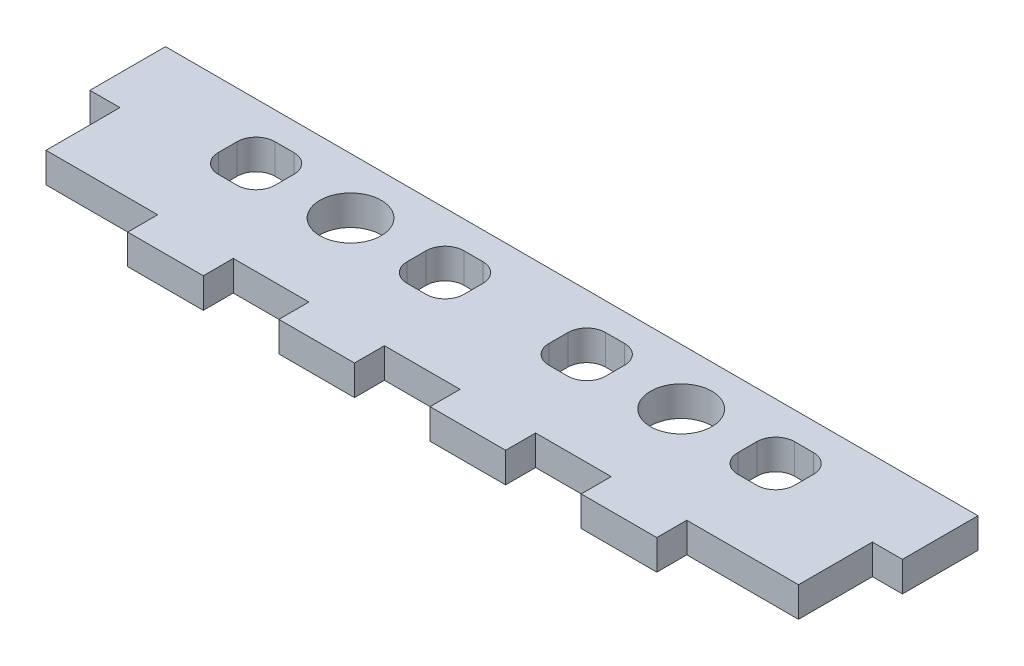
from build123d import *

# Parameters (mm, degrees)
SKETCH3_W           = 86
SKETCH3_H           = 30
BOSS_EXTRUDE1_DEPTH = 3.175
CUT_EXTRUDE1_REACH  = 93.138
SKETCH4_W           = 8
SKETCH4_H           = 3.175
SKETCH4_W_2         = 3.175
SKETCH4_H_2         = 11
CUT_EXTRUDE2_REACH  = 93.138
SKETCH5_R           = 3.25
CUT_EXTRUDE3_REACH  = 93.138
SKETCH6_W           = 79.65
SKETCH6_H           = 11
CUT_EXTRUDE4_REACH  = 93.138


with BuildPart() as part:
    # Sketch3 → Boss-Extrude1 (new body)
    with BuildSketch(Plane(origin=(0, 0, 0), x_dir=(1, 0, 0), z_dir=(0, 1, 0))):
        with Locations((43, -15)):
            Rectangle(SKETCH3_W, SKETCH3_H)
    extrude(amount=BOSS_EXTRUDE1_DEPTH)

    # Sketch4 → Cut-Extrude1 (cut, up to next)
    with BuildSketch(Plane(origin=(0, 3.175, 0), x_dir=(1, 0, 0), z_dir=(0, 1, 0)), mode=Mode.PRIVATE) as cut_extrude1_sk1:
        Polygon((0, -30), (15, -30), (15, -26.825), (3.175, -26.825), (3.175, -19), (0, -19), align=None)
    cut_extrude1_tool1 = extrude(cut_extrude1_sk1.sketch, amount=-CUT_EXTRUDE1_REACH, mode=Mode.PRIVATE) & part.part
    # Sketch4 → Cut-Extrude1 (cut, up to next)
    with BuildSketch(Plane(origin=(0, 3.175, 0), x_dir=(1, 0, 0), z_dir=(0, 1, 0)), mode=Mode.PRIVATE) as cut_extrude1_sk2:
        with Locations((27, -28.4125)):
            Rectangle(SKETCH4_W, SKETCH4_H)
    cut_extrude1_tool2 = extrude(cut_extrude1_sk2.sketch, amount=-CUT_EXTRUDE1_REACH, mode=Mode.PRIVATE) & part.part
    # Sketch4 → Cut-Extrude1 (cut, up to next)
    with BuildSketch(Plane(origin=(0, 3.175, 0), x_dir=(1, 0, 0), z_dir=(0, 1, 0)), mode=Mode.PRIVATE) as cut_extrude1_sk3:
        with Locations((43, -28.4125)):
            Rectangle(SKETCH4_W, SKETCH4_H)
    cut_extrude1_tool3 = extrude(cut_extrude1_sk3.sketch, amount=-CUT_EXTRUDE1_REACH, mode=Mode.PRIVATE) & part.part
    # Sketch4 → Cut-Extrude1 (cut, up to next)
    with BuildSketch(Plane(origin=(0, 3.175, 0), x_dir=(1, 0, 0), z_dir=(0, 1, 0)), mode=Mode.PRIVATE) as cut_extrude1_sk4:
        with Locations((1.5875, -5.5)):
            Rectangle(SKETCH4_W_2, SKETCH4_H_2)
    cut_extrude1_tool4 = extrude(cut_extrude1_sk4.sketch, amount=-CUT_EXTRUDE1_REACH, mode=Mode.PRIVATE) & part.part
    # Sketch4 → Cut-Extrude1 (cut, up to next)
    with BuildSketch(Plane(origin=(0, 3.175, 0), x_dir=(1, 0, 0), z_dir=(0, 1, 0)), mode=Mode.PRIVATE) as cut_extrude1_sk5:
        with Locations((59, -28.4125)):
            Rectangle(SKETCH4_W, SKETCH4_H)
    cut_extrude1_tool5 = extrude(cut_extrude1_sk5.sketch, amount=-CUT_EXTRUDE1_REACH, mode=Mode.PRIVATE) & part.part
    # Sketch4 → Cut-Extrude1 (cut, up to next)
    with BuildSketch(Plane(origin=(0, 3.175, 0), x_dir=(1, 0, 0), z_dir=(0, 1, 0)), mode=Mode.PRIVATE) as cut_extrude1_sk6:
        with Locations((84.4125, -5.5)):
            Rectangle(SKETCH4_W_2, SKETCH4_H_2)
    cut_extrude1_tool6 = extrude(cut_extrude1_sk6.sketch, amount=-CUT_EXTRUDE1_REACH, mode=Mode.PRIVATE) & part.part
    # Sketch4 → Cut-Extrude1 (cut, up to next)
    with BuildSketch(Plane(origin=(0, 3.175, 0), x_dir=(1, 0, 0), z_dir=(0, 1, 0)), mode=Mode.PRIVATE) as cut_extrude1_sk7:
        Polygon((71, -26.825), (71, -30), (86, -30), (86, -19), (82.825, -19), (82.825, -26.825), align=None)
    cut_extrude1_tool7 = extrude(cut_extrude1_sk7.sketch, amount=-CUT_EXTRUDE1_REACH, mode=Mode.PRIVATE) & part.part
    add(cut_extrude1_tool1.solids().sort_by_distance((7.5, 3.175, 29.813989))[0], mode=Mode.SUBTRACT)
    add(cut_extrude1_tool2.solids().sort_by_distance((27, 3.175, 28.4125))[0], mode=Mode.SUBTRACT)
    add(cut_extrude1_tool3.solids().sort_by_distance((43, 3.175, 28.4125))[0], mode=Mode.SUBTRACT)
    add(cut_extrude1_tool4.solids().sort_by_distance((1.5875, 3.175, 5.5))[0], mode=Mode.SUBTRACT)
    add(cut_extrude1_tool5.solids().sort_by_distance((59, 3.175, 28.4125))[0], mode=Mode.SUBTRACT)
    add(cut_extrude1_tool6.solids().sort_by_distance((84.4125, 3.175, 5.5))[0], mode=Mode.SUBTRACT)
    add(cut_extrude1_tool7.solids().sort_by_distance((76.9125, 3.175, 27.011011))[0], mode=Mode.SUBTRACT)

    # Sketch5 → Cut-Extrude2 (cut, up to next)
    with BuildSketch(Plane(origin=(0, 3.175, 0), x_dir=(1, 0, 0), z_dir=(0, 1, 0)), mode=Mode.PRIVATE) as cut_extrude2_sk1:
        with Locations((60.5, -16.915)):
            Circle(SKETCH5_R)
    cut_extrude2_tool1 = extrude(cut_extrude2_sk1.sketch, amount=-CUT_EXTRUDE2_REACH, mode=Mode.PRIVATE) & part.part
    # Sketch5 → Cut-Extrude2 (cut, up to next)
    with BuildSketch(Plane(origin=(0, 3.175, 0), x_dir=(1, 0, 0), z_dir=(0, 1, 0)), mode=Mode.PRIVATE) as cut_extrude2_sk2:
        with Locations((25.5, -16.915)):
            Circle(SKETCH5_R)
    cut_extrude2_tool2 = extrude(cut_extrude2_sk2.sketch, amount=-CUT_EXTRUDE2_REACH, mode=Mode.PRIVATE) & part.part
    add(cut_extrude2_tool1.solids().sort_by_distance((60.5, 3.175, 16.915))[0], mode=Mode.SUBTRACT)
    add(cut_extrude2_tool2.solids().sort_by_distance((25.5, 3.175, 16.915))[0], mode=Mode.SUBTRACT)

    # Sketch6 → Cut-Extrude3 (cut, up to next)
    with BuildSketch(Plane(origin=(0, 3.175, 0), x_dir=(1, 0, 0), z_dir=(0, 1, 0)), mode=Mode.PRIVATE) as cut_extrude3_sk1:
        with Locations((43, -5.5)):
            Rectangle(SKETCH6_W, SKETCH6_H)
    cut_extrude3_tool1 = extrude(cut_extrude3_sk1.sketch, amount=-CUT_EXTRUDE3_REACH, mode=Mode.PRIVATE) & part.part
    add(cut_extrude3_tool1.solids().sort_by_distance((43, 3.175, 5.5))[0], mode=Mode.SUBTRACT)

    # Sketch7 → Cut-Extrude4 (cut, up to next)
    with BuildSketch(Plane(origin=(0, 3.175, 0), x_dir=(1, 0, 0), z_dir=(0, 1, 0)), mode=Mode.PRIVATE) as cut_extrude4_sk1:
        with BuildLine():
            Line((14.5, -13.915), (16.5, -13.915))
            ThreePointArc((16.5, -13.915), (17.914213562, -14.500786438), (18.5, -15.915))
            Line((18.5, -15.915), (18.5, -17.915))
            ThreePointArc((18.5, -17.915), (17.914213562, -19.329213562), (16.5, -19.915))
            Line((16.5, -19.915), (14.5, -19.915))
            ThreePointArc((14.5, -19.915), (13.085786438, -19.329213562), (12.5, -17.915))
            Line((12.5, -17.915), (12.5, -15.915))
            ThreePointArc((12.5, -15.915), (13.085786438, -14.500786438), (14.5, -13.915))
        make_face()
    cut_extrude4_tool1 = extrude(cut_extrude4_sk1.sketch, amount=-CUT_EXTRUDE4_REACH, mode=Mode.PRIVATE) & part.part
    # Sketch7 → Cut-Extrude4 (cut, up to next)
    with BuildSketch(Plane(origin=(0, 3.175, 0), x_dir=(1, 0, 0), z_dir=(0, 1, 0)), mode=Mode.PRIVATE) as cut_extrude4_sk2:
        with BuildLine():
            Line((32.5, -15.915), (32.5, -17.915))
            ThreePointArc((32.5, -17.915), (33.085786438, -19.329213562), (34.5, -19.915))
            Line((34.5, -19.915), (36.5, -19.915))
            ThreePointArc((36.5, -19.915), (37.914213562, -19.329213562), (38.5, -17.915))
            Line((38.5, -17.915), (38.5, -15.915))
            ThreePointArc((38.5, -15.915), (37.914213562, -14.500786438), (36.5, -13.915))
            Line((36.5, -13.915), (34.5, -13.915))
            ThreePointArc((34.5, -13.915), (33.085786438, -14.500786438), (32.5, -15.915))
        make_face()
    cut_extrude4_tool2 = extrude(cut_extrude4_sk2.sketch, amount=-CUT_EXTRUDE4_REACH, mode=Mode.PRIVATE) & part.part
    # Sketch7 → Cut-Extrude4 (cut, up to next)
    with BuildSketch(Plane(origin=(0, 3.175, 0), x_dir=(1, 0, 0), z_dir=(0, 1, 0)), mode=Mode.PRIVATE) as cut_extrude4_sk3:
        with BuildLine():
            Line((49.5, -13.915), (51.5, -13.915))
            ThreePointArc((51.5, -13.915), (52.914213562, -14.500786438), (53.5, -15.915))
            Line((53.5, -15.915), (53.5, -17.915))
            ThreePointArc((53.5, -17.915), (52.914213562, -19.329213562), (51.5, -19.915))
            Line((51.5, -19.915), (49.5, -19.915))
            ThreePointArc((49.5, -19.915), (48.085786438, -19.329213562), (47.5, -17.915))
            Line((47.5, -17.915), (47.5, -15.915))
            ThreePointArc((47.5, -15.915), (48.085786438, -14.500786438), (49.5, -13.915))
        make_face()
    cut_extrude4_tool3 = extrude(cut_extrude4_sk3.sketch, amount=-CUT_EXTRUDE4_REACH, mode=Mode.PRIVATE) & part.part
    # Sketch7 → Cut-Extrude4 (cut, up to next)
    with BuildSketch(Plane(origin=(0, 3.175, 0), x_dir=(1, 0, 0), z_dir=(0, 1, 0)), mode=Mode.PRIVATE) as cut_extrude4_sk4:
        with BuildLine():
            Line((67.5, -15.915), (67.5, -17.915))
            ThreePointArc((67.5, -17.915), (68.085786438, -19.329213562), (69.5, -19.915))
            Line((69.5, -19.915), (71.5, -19.915))
            ThreePointArc((71.5, -19.915), (72.914213562, -19.329213562), (73.5, -17.915))
            Line((73.5, -17.915), (73.5, -15.915))
            ThreePointArc((73.5, -15.915), (72.914213562, -14.500786438), (71.5, -13.915))
            Line((71.5, -13.915), (69.5, -13.915))
            ThreePointArc((69.5, -13.915), (68.085786438, -14.500786438), (67.5, -15.915))
        make_face()
    cut_extrude4_tool4 = extrude(cut_extrude4_sk4.sketch, amount=-CUT_EXTRUDE4_REACH, mode=Mode.PRIVATE) & part.part
    add(cut_extrude4_tool1.solids().sort_by_distance((15.5, 3.175, 16.915))[0], mode=Mode.SUBTRACT)
    add(cut_extrude4_tool2.solids().sort_by_distance((35.5, 3.175, 16.915))[0], mode=Mode.SUBTRACT)
    add(cut_extrude4_tool3.solids().sort_by_distance((50.5, 3.175, 16.915))[0], mode=Mode.SUBTRACT)
    add(cut_extrude4_tool4.solids().sort_by_distance((70.5, 3.175, 16.915))[0], mode=Mode.SUBTRACT)


solid = part.part
